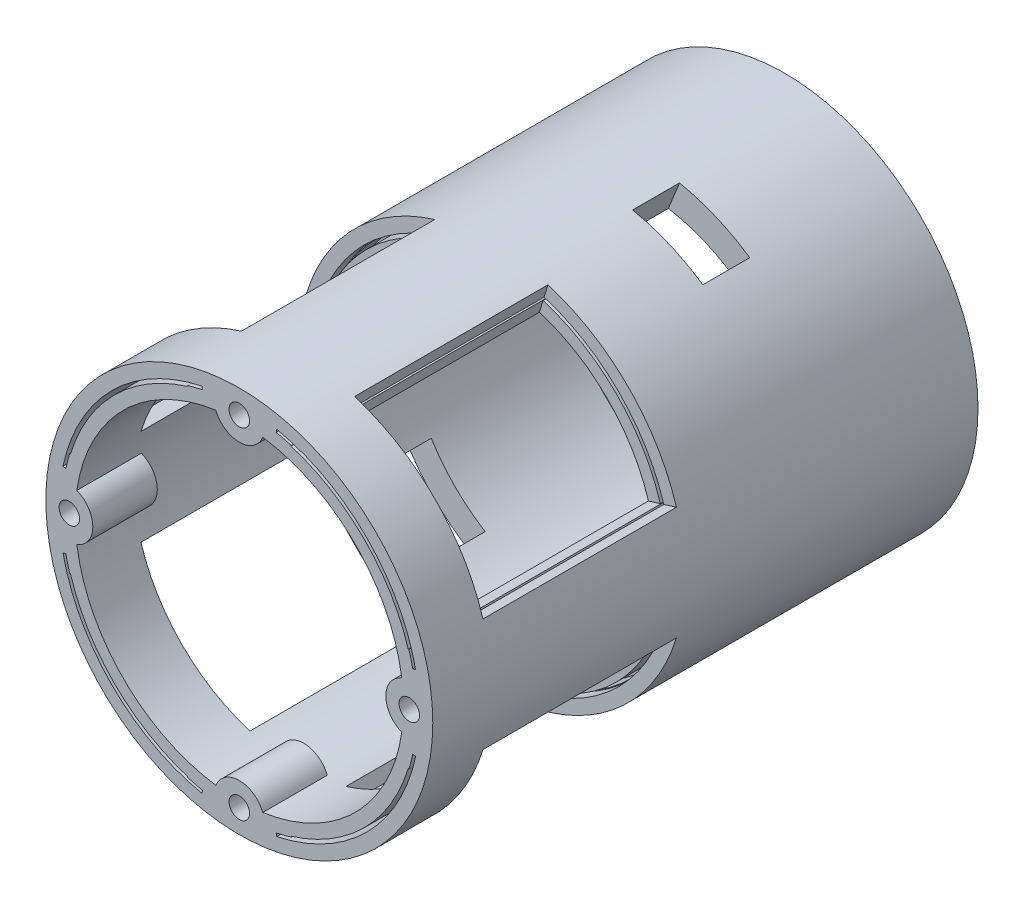
from build123d import *

# Parameters (mm, degrees)
CROQUIS1_R               = 33
CROQUIS1_R_2             = 28
BOSS_EXTRUDE1_DEPTH      = 93
CORTAR_EXTRUIR1_DEPTH    = 45
CORTAR_REVOLUCI_N2_ANGLE = 56
MATRIZC2_COUNT           = 4
BOSS_EXTRUDE4_DEPTH      = 11
SKETCH9_R                = 1.75
CUT_EXTRUDE3_DEPTH       = 10
SKETCH10_W               = 7
SKETCH10_H               = 15
SKETCH10_W_2             = 8
SKETCH10_H_2             = 13
CORTE_USB_Y_SWITCH_DEPTH = 10
SKETCH11_W               = 8
SKETCH11_H               = 13
CUT_EXTRUDE5_DEPTH       = 10


with BuildPart() as part:
    # Croquis1 → Boss-Extrude1 (new body)
    with BuildSketch(Plane.XY):
        Circle(CROQUIS1_R)
        Circle(CROQUIS1_R_2, mode=Mode.SUBTRACT)
    extrude(amount=BOSS_EXTRUDE1_DEPTH)

    # Croquis2 → Cortar-Extruir1 (cut)
    with BuildSketch(Plane.XY.offset(93)):
        with BuildLine():
            Line((-30.078038723, -6.393284493), (-29.588964922, -6.289328647))
            ThreePointArc((-29.588964922, -6.289328647), (-21.389980131, -21.389980131), (-6.289328647, -29.588964922))
            Line((-6.289328647, -29.588964922), (-6.393284493, -30.078038723))
            ThreePointArc((-6.393284493, -30.078038723), (-21.743533521, -21.743533521), (-30.078038723, -6.393284493))
        make_face()
        with BuildLine():
            Line((-30.078038723, 6.393284493), (-29.588964922, 6.289328647))
            ThreePointArc((-29.588964922, 6.289328647), (-21.389980131, 21.389980131), (-6.289328647, 29.588964922))
            Line((-6.289328647, 29.588964922), (-6.393284493, 30.078038723))
            ThreePointArc((-6.393284493, 30.078038723), (-21.743533521, 21.743533521), (-30.078038723, 6.393284493))
        make_face()
        with BuildLine():
            Line((6.393284493, 30.078038723), (6.289328647, 29.588964922))
            ThreePointArc((6.289328647, 29.588964922), (21.389980131, 21.389980131), (29.588964922, 6.289328647))
            Line((29.588964922, 6.289328647), (30.078038723, 6.393284493))
            ThreePointArc((30.078038723, 6.393284493), (21.743533521, 21.743533521), (6.393284493, 30.078038723))
        make_face()
        with BuildLine():
            Line((30.078038723, -6.393284493), (29.588964922, -6.289328647))
            ThreePointArc((29.588964922, -6.289328647), (21.389980131, -21.389980131), (6.289328647, -29.588964922))
            Line((6.289328647, -29.588964922), (6.393284493, -30.078038723))
            ThreePointArc((6.393284493, -30.078038723), (21.743533521, -21.743533521), (30.078038723, -6.393284493))
        make_face()
    extrude(amount=-CORTAR_EXTRUIR1_DEPTH, mode=Mode.SUBTRACT)

    # Croquis4 → Cortar-Revolución2 (revolve, cut)
    with BuildSketch(Plane(origin=(0, 0, 0), x_dir=(0, 0, -1), z_dir=(0.9563047559630379, -0.29237170472272933, 0))):
        Polygon((-83, 33), (-83, 30.633938292), (-93, 30.633938292), (-93, 30.133938292), (-83, 30.133938292), (-83, 27.767876584), (-50, 27.767876584), (-50, 30.133938292), (-45, 30.133938292), (-45, 30.633938292), (-50, 30.633938292), (-50, 33), align=None)
    cortar_revoluci_n2 = revolve(axis=Axis((0, 0, 93), (0, 0, -1)), revolution_arc=CORTAR_REVOLUCI_N2_ANGLE, mode=Mode.SUBTRACT)

    # MatrizC2: Cortar-Revolución2 ×4 about axis
    matrizc2_axis = Axis((0, 0, 93), (0, 0, -1))
    for i in range(1, MATRIZC2_COUNT):
        add(cortar_revoluci_n2.rotate(matrizc2_axis, i * 360 / MATRIZC2_COUNT), mode=Mode.SUBTRACT)

    # Sketch8 → Boss-Extrude4 (add)
    with BuildSketch(Plane(origin=(0, 0, 0), x_dir=(-1, 0, 0), z_dir=(0, 0, -1))):
        with BuildLine():
            ThreePointArc((-4, -27.712812921), (0, -28), (4, -27.712812921))
            ThreePointArc((4, -27.712812921), (0, -24.990786305), (-4, -27.712812921))
        make_face()
        with BuildLine():
            ThreePointArc((-27.712812921, 4), (-28, 0), (-27.712812921, -4))
            ThreePointArc((-27.712812921, -4), (-24.990786305, 0), (-27.712812921, 4))
        make_face()
        with BuildLine():
            ThreePointArc((4, 27.712812921), (0, 28), (-4, 27.712812921))
            ThreePointArc((-4, 27.712812921), (0, 24.990786305), (4, 27.712812921))
        make_face()
        with BuildLine():
            ThreePointArc((27.712812921, -4), (28, 0), (27.712812921, 4))
            ThreePointArc((27.712812921, 4), (24.990786305, 0), (27.712812921, -4))
        make_face()
    boss_extrude4 = extrude(amount=-BOSS_EXTRUDE4_DEPTH)

    # Sketch9 → Cut-Extrude3 (cut)
    with BuildSketch(Plane(origin=(0, 0, 0), x_dir=(-1, 0, 0), z_dir=(0, 0, -1))):
        with Locations((0, -29)):
            Circle(SKETCH9_R)
        with Locations((-29, 0)):
            Circle(SKETCH9_R)
        with Locations((0, 29)):
            Circle(SKETCH9_R)
        with Locations((29, 0)):
            Circle(SKETCH9_R)
    cut_extrude3 = extrude(amount=-CUT_EXTRUDE3_DEPTH, mode=Mode.SUBTRACT)

    # Mirror1: Boss-Extrude4, Cut-Extrude3 across plane
    add(boss_extrude4.mirror(Plane.XY.offset(46.5)))
    add(cut_extrude3.mirror(Plane.XY.offset(46.5)), mode=Mode.SUBTRACT)

    # Sketch10 → Corte USB y Switch (cut)
    with BuildSketch(Plane(origin=(-23.334523779, -23.334523779, 0), x_dir=(0, 0, -1), z_dir=(-0.7071067811865488, -0.7071067811865464, 0))):
        with Locations((-7, 0)):
            Rectangle(SKETCH10_W, SKETCH10_H)
        with Locations((-40.4, 0)):
            Rectangle(SKETCH10_W_2, SKETCH10_H_2)
    extrude(amount=-CORTE_USB_Y_SWITCH_DEPTH, mode=Mode.SUBTRACT)

    # Sketch11 → Cut-Extrude5 (cut)
    with BuildSketch(Plane(origin=(12.362017583, 30.597067201, 0), x_dir=(0, 0, -1), z_dir=(0.37460659341590646, 0.9271838545667896, 0))):
        with Locations((-28.5, -0.5)):
            Rectangle(SKETCH11_W, SKETCH11_H)
    extrude(amount=-CUT_EXTRUDE5_DEPTH, mode=Mode.SUBTRACT)


solid = part.part
